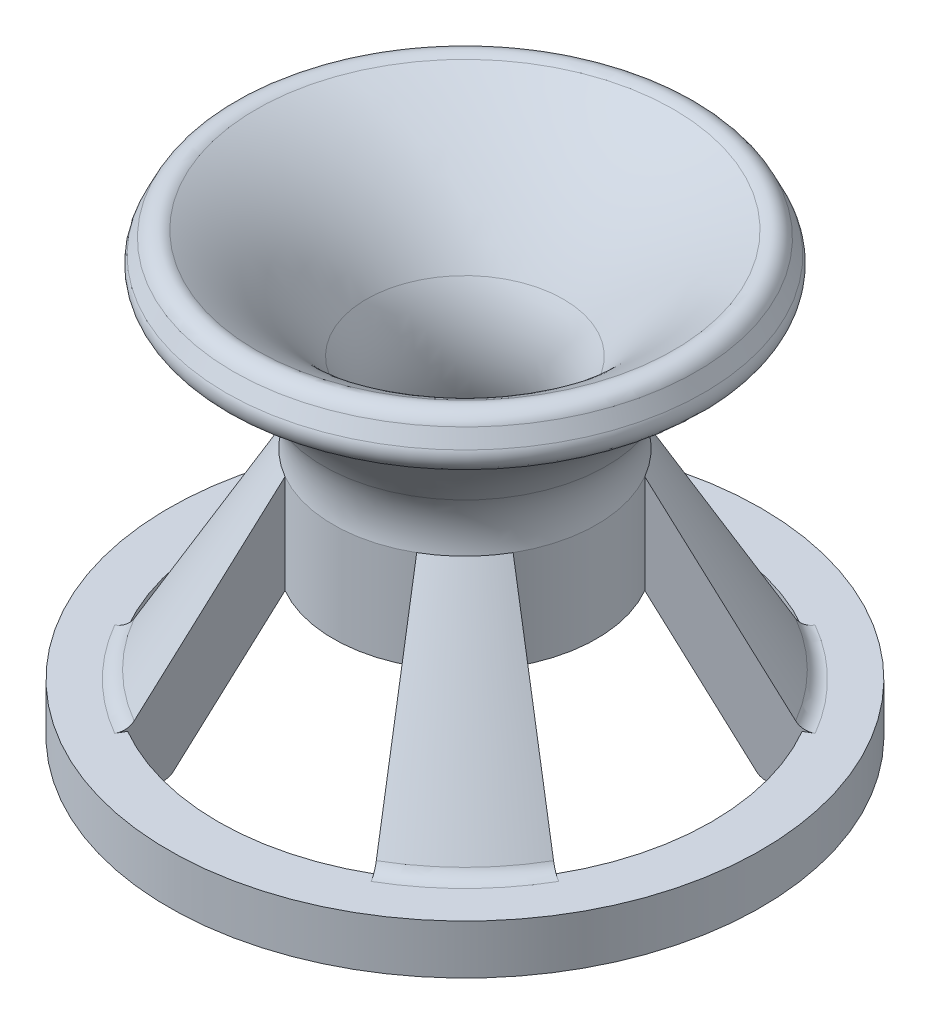
from build123d import *

# Parameters (mm, degrees)
CUT_EXTRUDE1_DEPTH = 7.562178
FILLET1_R          = 0.5


with BuildPart() as part:
    # Sketch1 → Revolve1 (revolve)
    with BuildSketch(Plane.XY, mode=Mode.PRIVATE) as revolve1_sk:
        with BuildLine():
            Line((6.633974596215569, -1.2e-16), (8.999999999999998, -4.52e-15))
            Line((8.999999999999998, -4.52e-15), (8.999999999999998, 1.4999999999999956))
            Line((8.999999999999998, 1.4999999999999956), (7.5, 1.5))
            Line((7.5, 1.5), (4, 7.562177826491056))
            ThreePointArc((4, 7.562177826491056), (3.99763327378791, 8.432186632808357), (4.294453456567456, 9.249999999999998))
            ThreePointArc((4.294453456567456, 9.249999999999998), (5.662653405718452, 10.973935293777526), (7.4723600696108665, 12.226487004746774))
            Line((7.4723600696108665, 12.226487004746774), (6.808903286542892, 13.57178440569613))
            ThreePointArc((6.808903286542892, 13.57178440569613), (4.6372552898719945, 12.068722352533033), (2.995415350890799, 10))
            ThreePointArc((2.995415350890799, 10), (2.4999999999999996, 8.15108473962598), (2.995415350890799, 6.302169479251957))
            Line((2.995415350890799, 6.302169479251957), (6.633974596215569, -1.2e-16))
        make_face()
    revolve(revolve1_sk.sketch.rotate(Axis((0, 0, 0), (0, 1, 0)), 90), axis=Axis((0, 0, 0), (0, 1, 0)))

    # Sketch2 → Cut-Extrude1 (cut)
    with BuildSketch(Plane(origin=(0, 0, 0), x_dir=(1, 0, 0), z_dir=(0, 1, 0))):
        with BuildLine():
            Line((-3.749999941549397, 6.495190562129763), (-1.999999941549405, 3.4641016488842244))
            ThreePointArc((-1.999999941549405, 3.4641016488842244), (2.4e-16, 4.0000000000000036), (1.999999941549405, 3.4641016488842244))
            Line((1.999999941549405, 3.4641016488842244), (3.749999941549397, 6.495190562129763))
            ThreePointArc((3.749999941549397, 6.495190562129763), (4.6e-16, 7.500000000000002), (-3.749999941549397, 6.495190562129763))
        make_face()
        with BuildLine():
            Line((6.495190562129763, 3.7499999415493974), (3.4641016488842244, 1.999999941549405))
            ThreePointArc((3.4641016488842244, 1.999999941549405), (4.0000000000000036, 0), (3.4641016488842244, -1.999999941549405))
            Line((3.4641016488842244, -1.999999941549405), (6.495190562129763, -3.7499999415493965))
            ThreePointArc((6.495190562129763, -3.7499999415493965), (7.500000000000002, 0), (6.495190562129763, 3.7499999415493974))
        make_face()
        with BuildLine():
            Line((3.749999941549398, -6.495190562129762), (1.9999999415494054, -3.464101648884224))
            ThreePointArc((1.9999999415494054, -3.464101648884224), (2.4e-16, -4.0000000000000036), (-1.9999999415494045, -3.464101648884225))
            Line((-1.9999999415494045, -3.464101648884225), (-3.749999941549396, -6.495190562129764))
            ThreePointArc((-3.749999941549396, -6.495190562129764), (2.12e-15, -7.500000000000003), (3.749999941549398, -6.495190562129762))
        make_face()
        with BuildLine():
            Line((-6.495190562129762, -3.7499999415493983), (-3.464101648884224, -1.9999999415494054))
            ThreePointArc((-3.464101648884224, -1.9999999415494054), (-4.0000000000000036, 4.9e-16), (-3.464101648884225, 1.9999999415494045))
            Line((-3.464101648884225, 1.9999999415494045), (-6.495190562129764, 3.7499999415493956))
            ThreePointArc((-6.495190562129764, 3.7499999415493956), (-7.500000000000002, -2.41e-15), (-6.495190562129762, -3.7499999415493983))
        make_face()
    extrude(amount=CUT_EXTRUDE1_DEPTH, mode=Mode.SUBTRACT)

    # Fillet1
    # the kernel refuses this fillet: 0.5 mm, written as the material it adds along each edge
    with BuildSketch(Plane(origin=(0, 1.5, 0), x_dir=(0.8660254082839624, 0, -0.49999999220659597), z_dir=(0.49999999220659597, 0, 0.8660254082839624))) as fillet1_piece_1:
        with BuildLine():
            CenterArc((7.499999999999999 + FILLET1_R * 0.57735026919, FILLET1_R), FILLET1_R, 209.99999999999957, 60.000000000000455)
            Line((7.499999999999999 - FILLET1_R * 0.288675134595, FILLET1_R * 0.5), (7.499999999999999, 0))
            Line((7.499999999999999, 0), (7.499999999999999 + FILLET1_R * 0.57735026919, -4.44e-15))
        make_face()
    revolve(axis=Axis((0, 1.5, 0), (0, 1, 0)), revolution_arc=30.000001031215383)
    with BuildSketch(Plane(origin=(0, 1.5, 0), x_dir=(0.4999999922066019, 0, 0.8660254082839591), z_dir=(-0.8660254082839591, 0, 0.4999999922066019))) as fillet1_piece_2:
        with BuildLine():
            CenterArc((7.5 + FILLET1_R * 0.57735026919, FILLET1_R), FILLET1_R, 209.99999999999957, 60.000000000000455)
            Line((7.5 - FILLET1_R * 0.288675134595, FILLET1_R * 0.5), (7.5, 0))
            Line((7.5, 0), (7.5 + FILLET1_R * 0.57735026919, -4.44e-15))
        make_face()
    revolve(axis=Axis((0, 1.5, 0), (0, 1, 0)), revolution_arc=30.000001031214644)
    with BuildSketch(Plane(origin=(0, 1.5, 0), x_dir=(-0.8660254082839636, 0, 0.49999999220659425), z_dir=(-0.49999999220659425, 0, -0.8660254082839636))) as fillet1_piece_3:
        with BuildLine():
            CenterArc((7.5 + FILLET1_R * 0.57735026919, FILLET1_R), FILLET1_R, 209.99999999999963, 60.00000000000034)
            Line((7.5 - FILLET1_R * 0.288675134595, FILLET1_R * 0.5), (7.5, 0))
            Line((7.5, 0), (7.5 + FILLET1_R * 0.57735026919, -4.44e-15))
        make_face()
    revolve(axis=Axis((0, 1.5, 0), (0, 1, 0)), revolution_arc=30.000001031214545)
    with BuildSketch(Plane(origin=(0, 1.5, 0), x_dir=(-0.49999999220658903, 0, -0.8660254082839666), z_dir=(0.8660254082839666, 0, -0.49999999220658903))) as fillet1_piece_4:
        with BuildLine():
            CenterArc((7.499999999999999 + FILLET1_R * 0.57735026919, FILLET1_R), FILLET1_R, 210.00000000000003, 59.99999999999987)
            Line((7.499999999999999 + FILLET1_R * 0.57735026919, 4.4e-16), (7.499999999999999, 0))
            Line((7.499999999999999, 0), (7.499999999999999 - FILLET1_R * 0.288675134595, FILLET1_R * 0.5))
        make_face()
    revolve(axis=Axis((0, 1.5, 0), (0, 1, 0)), revolution_arc=30.00000103121539)
    # the kernel refuses this fillet: 0.5 mm, written as the material it takes off along each edge
    with BuildSketch(Plane(origin=(0, -1.2e-16, 0), x_dir=(0.9151940117210042, 0, -0.40301354928837607), z_dir=(0.40301354928837607, 0, 0.9151940117210042))) as fillet1_2_piece_1:
        with BuildLine():
            CenterArc((6.633974596215569 + FILLET1_R * 0.57735026919, FILLET1_R), FILLET1_R, 210.00000000000003, 59.99999999999987)
            Line((6.633974596215569 + FILLET1_R * 0.57735026919, -1.27e-15), (6.633974596215569, 1.2e-16))
            Line((6.633974596215569, 1.2e-16), (6.633974596215569 - FILLET1_R * 0.288675134595, FILLET1_R * 0.5))
        make_face()
    revolve(axis=Axis((0, -1.2e-16, 0), (0, 1, 0)), revolution_arc=42.466588641203785, mode=Mode.SUBTRACT)
    with BuildSketch(Plane(origin=(0, -1.2e-16, 0), x_dir=(0.40301354928837646, 0, 0.915194011721004), z_dir=(-0.915194011721004, 0, 0.40301354928837646))) as fillet1_2_piece_2:
        with BuildLine():
            CenterArc((6.633974596215568 + FILLET1_R * 0.57735026919, FILLET1_R), FILLET1_R, 210.00000000000006, 59.999999999999844)
            Line((6.633974596215568 + FILLET1_R * 0.57735026919, -3.3e-16), (6.633974596215568, 1.2e-16))
            Line((6.633974596215568, 1.2e-16), (6.633974596215568 - FILLET1_R * 0.288675134595, FILLET1_R * 0.5))
        make_face()
    revolve(axis=Axis((0, -1.2e-16, 0), (0, 1, 0)), revolution_arc=42.466588641203685, mode=Mode.SUBTRACT)
    with BuildSketch(Plane(origin=(0, -1.2e-16, 0), x_dir=(-0.915194011721004, 0, 0.4030135492883765), z_dir=(-0.4030135492883765, 0, -0.915194011721004))) as fillet1_2_piece_3:
        with BuildLine():
            CenterArc((6.633974596215569 + FILLET1_R * 0.57735026919, FILLET1_R), FILLET1_R, 210.0000000000001, 59.999999999999886)
            Line((6.633974596215569 + FILLET1_R * 0.57735026919, -1.21e-15), (6.633974596215569, 1.2e-16))
            Line((6.633974596215569, 1.2e-16), (6.633974596215569 - FILLET1_R * 0.288675134595, FILLET1_R * 0.5))
        make_face()
    revolve(axis=Axis((0, -1.2e-16, 0), (0, 1, 0)), revolution_arc=42.466588641203685, mode=Mode.SUBTRACT)
    with BuildSketch(Plane(origin=(0, -1.2e-16, 0), x_dir=(-0.40301354928837607, 0, -0.9151940117210042), z_dir=(0.9151940117210042, 0, -0.40301354928837607))) as fillet1_2_piece_4:
        with BuildLine():
            CenterArc((6.63397459621557 + FILLET1_R * 0.57735026919, FILLET1_R), FILLET1_R, 210.00000000000006, 59.99999999999994)
            Line((6.63397459621557 + FILLET1_R * 0.57735026919, -1.21e-15), (6.63397459621557, 1.2e-16))
            Line((6.63397459621557, 1.2e-16), (6.63397459621557 - FILLET1_R * 0.288675134595, FILLET1_R * 0.5))
        make_face()
    revolve(axis=Axis((0, -1.2e-16, 0), (0, 1, 0)), revolution_arc=42.46658864120374, mode=Mode.SUBTRACT)
    with BuildSketch(Plane(origin=(0, 13.571784405696132, 0), x_dir=(1.1e-16, 0, -1), z_dir=(1, 0, 1.1e-16))) as fillet1_2_piece_5:
        with BuildLine():
            CenterArc((6.5881331953149616, -0.6827853473273997), FILLET1_R, 26.25101140415418, 93.3722866833914)
            Line((7.036565662297915, -0.46163308630440625), (6.808903286542892, 0))
            ThreePointArc((6.808903286542892, 0), (6.573118661901752, -0.12062636424792572), (6.3409855018069745, -0.2481383438939453))
        make_face()
    revolve(axis=Axis((0, 13.571784405696132, 0), (0, 1, 0)), mode=Mode.SUBTRACT)
    with BuildSketch(Plane(origin=(0, 12.226487004746774, 0), x_dir=(1.1e-16, 0, -1), z_dir=(1, 0, 1.1e-16))) as fillet1_2_piece_6:
        with BuildLine():
            CenterArc((6.809693112007429, 0.21325297950030375), FILLET1_R, 299.8343331025833, 86.41667830167688)
            Line((7.258125578989974, 0.43440524052412677), (7.4723600696108665, 0))
            ThreePointArc((7.4723600696108665, 0), (7.263676285711675, -0.10700426181869638), (7.058440041566387, -0.22048076951513984))
        make_face()
    revolve(axis=Axis((0, 12.226487004746774, 0), (0, 1, 0)), mode=Mode.SUBTRACT)


solid = part.part
